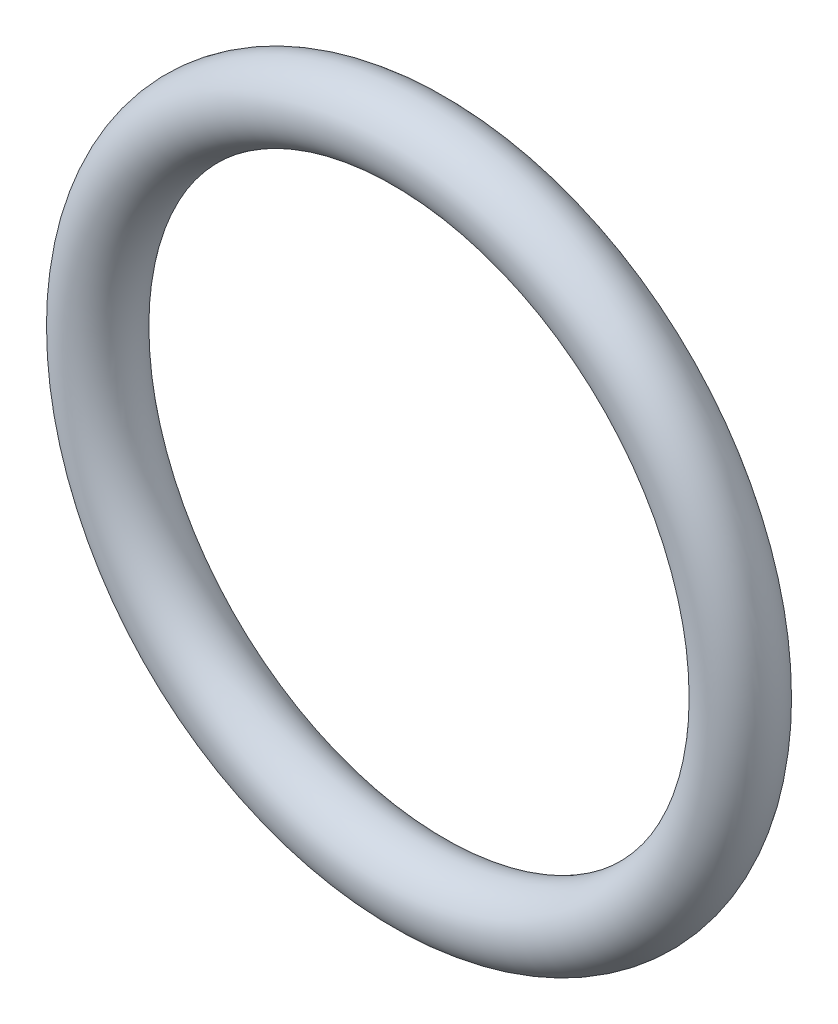
from build123d import *

# Parameters (mm, degrees)
SKETCH1_R = 0.889


with BuildPart() as part:
    # Sketch1 → Revolve1 (revolve)
    with BuildSketch(Plane(origin=(0, 0, 0), x_dir=(0, 0, -1), z_dir=(1, 0, 0))):
        with Locations((0, 7.8867)):
            Circle(SKETCH1_R)
    revolve(axis=Axis((0, 0, 7.451954658), (0, 0, -1)))


solid = part.part
